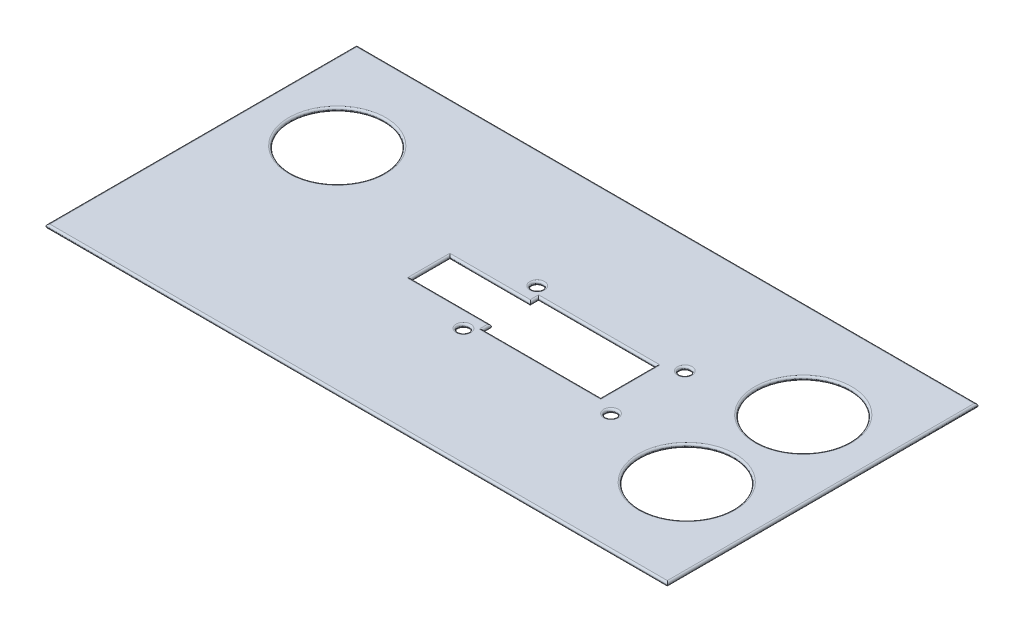
from build123d import *

# Parameters (mm, degrees)
SKETCH1_R           = 12
SKETCH1_R_2         = 1.4
BOSS_EXTRUDE1_DEPTH = 1
FILLET1_R           = 0.5


with BuildPart() as part:
    # Sketch1 → Boss-Extrude1 (new body)
    with BuildSketch(Plane(origin=(0, 0, 0), x_dir=(1, 0, 0), z_dir=(0, 1, 0))):
        Polygon((-96, 15), (-96, -40), (64, -40), (64, 15), (64, 40), (-96, 40), align=None)
        with Locations(Location((44, 15, 0), (0, 0, 270))):
            Circle(SKETCH1_R, mode=Mode.SUBTRACT)
        with Locations(Location((-76, 15, 0), (0, 0, 270))):
            Circle(SKETCH1_R, mode=Mode.SUBTRACT)
        with Locations(Location((19, -9.5, 0), (0, 0, 270))):
            Circle(SKETCH1_R_2, mode=Mode.SUBTRACT)
        with Locations(Location((-19, -9.5, 0), (0, 0, 270))):
            Circle(SKETCH1_R_2, mode=Mode.SUBTRACT)
        with Locations(Location((-19, 9.5, 0), (0, 0, 270))):
            Circle(SKETCH1_R_2, mode=Mode.SUBTRACT)
        with Locations(Location((19, 9.5, 0), (0, 0, 270))):
            Circle(SKETCH1_R_2, mode=Mode.SUBTRACT)
        with Locations(Location((44, -15, 0), (0, 0, 270))):
            Circle(SKETCH1_R, mode=Mode.SUBTRACT)
        Polygon((-37, 5), (-16.3, 5), (-16.3, 7.15), (14, 7.15), (14, -7.15), (-16.3, -7.15), (-16.3, -5), (-37, -5), align=None, mode=Mode.SUBTRACT)
    extrude(amount=BOSS_EXTRUDE1_DEPTH)

    # Fillet1
    fillet1_edges = [part.edges().sort_by_distance(p)[0] for p in [
        (19, 0, -10.9),
        (-19, 0, -10.9),
        (19, 0, 8.1),
        (-19, 0, 8.1),
        (-26.65, 0, 5),
        (-37, 0, 0),
        (-26.65, 0, -5),
        (-16, 0, 40),
        (64, 0, 0),
        (-16, 0, -40),
        (-96, 0, 0),
        (44, 0, -27),
        (-76, 0, -27),
        (44, 0, 3),
        (19, 1, -10.9),
        (19, 1, 8.1),
        (-37, 1, 0),
        (-26.65, 1, 5),
        (-26.65, 1, -5),
        (44, 1, 3),
        (44, 1, -27),
        (-16, 1, -40),
        (64, 1, 0),
        (-16, 1, 40),
        (-96, 1, 0),
        (-76, 1, -27),
        (-19, 1, 8.1),
        (-19, 1, -10.9),
        (-1.15, 0, -7.15),
        (14, 0, 0),
        (-1.15, 0, 7.15),
        (14, 1, 0),
        (-1.15, 1, -7.15),
        (-1.15, 1, 7.15),
        (-16.3, 0, -6.075),
        (-16.3, 0, 6.075),
        (-16.3, 1, -6.075),
        (-16.3, 1, 6.075),
    ]]
    fillet(fillet1_edges, radius=FILLET1_R - 0.0001)  # a hair under: the kernel refuses the full size


solid = part.part
